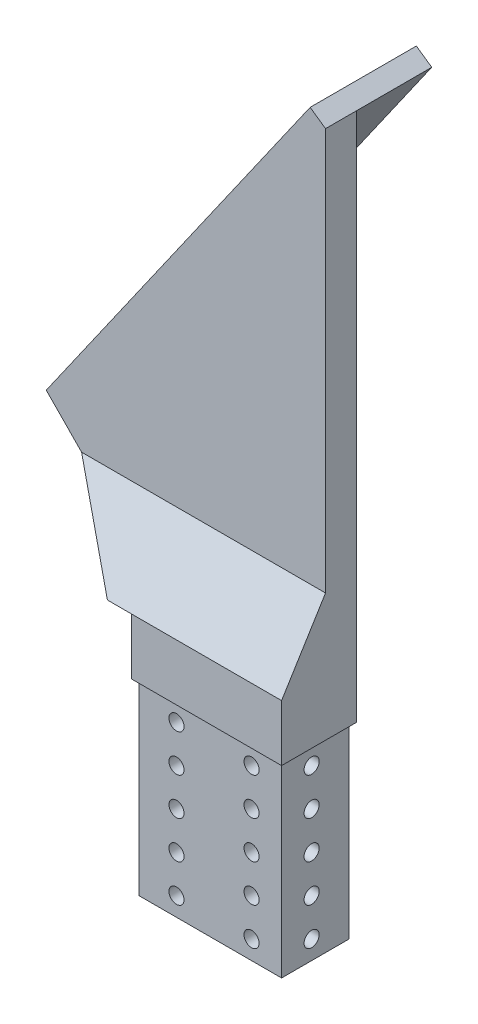
from build123d import *

# Parameters (mm, degrees)
BOSS_EXTRUDE1_DEPTH = 25.4
SKETCH3_W           = 50.8
SKETCH3_H           = 63.5
CUT_EXTRUDE1_DEPTH  = 1.27
SKETCH4_W           = 25.4
SKETCH4_H           = 63.5
CUT_EXTRUDE2_DEPTH  = 1.27
SKETCH5_W           = 50.8
SKETCH5_H           = 63.5
CUT_EXTRUDE3_DEPTH  = 1.27
SKETCH6_W           = 25.4
SKETCH6_H           = 63.5
CUT_EXTRUDE4_DEPTH  = 1.27
SKETCH7_W           = 101.6
SKETCH7_H           = 171.45
CUT_EXTRUDE5_DEPTH  = 298.299377732
CUT_EXTRUDE7_DEPTH  = 275.74300719
CUT_EXTRUDE6_DEPTH  = 275.74300719
CUT_EXTRUDE8_DEPTH  = 270.171161327
SKETCH11_R          = 2.5527
CUT_EXTRUDE9_DEPTH  = 257.980175398
SKETCH12_R          = 2.5527
CUT_EXTRUDE10_DEPTH = 258.446718511
BOSS_EXTRUDE2_DEPTH = 25.4
CUT_EXTRUDE11_DEPTH = 263.236499242
CUT_EXTRUDE12_DEPTH = 261.839402023
CUT_EXTRUDE13_DEPTH = 266.056834631


with BuildPart() as part:
    # Sketch1 → Boss-Extrude1 (new body)
    with BuildSketch(Plane.XY):
        Polygon((50.8, 82.55), (152.4, 82.55), (152.4, 254), (-101.6, 254), (-101.6, 82.55), (0, 82.55), (0, 0), (50.8, 0), align=None)
    extrude(amount=BOSS_EXTRUDE1_DEPTH)

    # Sketch3 → Cut-Extrude1 (cut)
    with BuildSketch(Plane.XY.offset(25.4)):
        with Locations((25.4, 31.75)):
            Rectangle(SKETCH3_W, SKETCH3_H)
    extrude(amount=-CUT_EXTRUDE1_DEPTH, mode=Mode.SUBTRACT)

    # Sketch4 → Cut-Extrude2 (cut)
    with BuildSketch(Plane.ZY):
        with Locations((12.7, 31.75)):
            Rectangle(SKETCH4_W, SKETCH4_H)
    extrude(amount=-CUT_EXTRUDE2_DEPTH, mode=Mode.SUBTRACT)

    # Sketch5 → Cut-Extrude3 (cut)
    with BuildSketch(Plane(origin=(0, 0, 0), x_dir=(-1, 0, 0), z_dir=(0, 0, -1))):
        with Locations((-25.4, 31.75)):
            Rectangle(SKETCH5_W, SKETCH5_H)
    extrude(amount=-CUT_EXTRUDE3_DEPTH, mode=Mode.SUBTRACT)

    # Sketch6 → Cut-Extrude4 (cut)
    with BuildSketch(Plane(origin=(50.8, 0, 0), x_dir=(0, 0, -1), z_dir=(1, 0, 0))):
        with Locations((-12.7, 31.75)):
            Rectangle(SKETCH6_W, SKETCH6_H)
    extrude(amount=-CUT_EXTRUDE4_DEPTH, mode=Mode.SUBTRACT)

    # Sketch7 → Cut-Extrude5 (cut, through all)
    with BuildSketch(Plane.XY.offset(25.4)):
        with Locations((101.6, 168.275)):
            Rectangle(SKETCH7_W, SKETCH7_H)
    extrude(amount=-CUT_EXTRUDE5_DEPTH, mode=Mode.SUBTRACT)

    # Sketch9 → Cut-Extrude7 (cut, through all)
    with BuildSketch(Plane.XY.offset(25.4)):
        Polygon((34.65764308, 254), (50.8, 254), (50.8, 242.697), align=None)
    extrude(amount=-CUT_EXTRUDE7_DEPTH, mode=Mode.SUBTRACT)

    # Sketch8 → Cut-Extrude6 (cut, through all)
    with BuildSketch(Plane.XY.offset(25.4)):
        Polygon((34.65764308, 254), (-101.6, 59.403918632), (-101.6, 254), align=None)
    extrude(amount=-CUT_EXTRUDE6_DEPTH, mode=Mode.SUBTRACT)

    # Sketch10 → Cut-Extrude8 (cut, through all)
    with BuildSketch(Plane.XY.offset(25.4)):
        Polygon((34.65764308, 254), (45.59768076, 246.339703148), (-84.029822158, 61.212443237), (-94.969859838, 68.872740089), align=None)
    extrude(amount=-CUT_EXTRUDE8_DEPTH, mode=Mode.SUBTRACT)

    # Sketch11 → Cut-Extrude9 (cut, through all)
    with BuildSketch(Plane.XY.offset(24.13)):
        with Locations((13.97, 57.15)):
            Circle(SKETCH11_R)
        with Locations((13.97, 44.45)):
            Circle(SKETCH11_R)
        with Locations((13.97, 31.75)):
            Circle(SKETCH11_R)
        with Locations((13.97, 19.05)):
            Circle(SKETCH11_R)
        with Locations((13.97, 6.35)):
            Circle(SKETCH11_R)
        with Locations((39.37, 44.45)):
            Circle(SKETCH11_R)
        with Locations((39.37, 31.75)):
            Circle(SKETCH11_R)
        with Locations((39.37, 19.05)):
            Circle(SKETCH11_R)
        with Locations((39.37, 6.35)):
            Circle(SKETCH11_R)
        with Locations((39.37, 57.15)):
            Circle(SKETCH11_R)
    extrude(amount=-CUT_EXTRUDE9_DEPTH, mode=Mode.SUBTRACT)

    # Sketch12 → Cut-Extrude10 (cut, through all)
    with BuildSketch(Plane.ZY.offset(-1.27)):
        with Locations((13.97, 57.15)):
            Circle(SKETCH12_R)
        with Locations((13.97, 44.45)):
            Circle(SKETCH12_R)
        with Locations((13.97, 31.75)):
            Circle(SKETCH12_R)
        with Locations((13.97, 19.05)):
            Circle(SKETCH12_R)
        with Locations((13.97, 6.35)):
            Circle(SKETCH12_R)
    extrude(amount=-CUT_EXTRUDE10_DEPTH, mode=Mode.SUBTRACT)

    # Sketch17 → Boss-Extrude2 (add)
    with BuildSketch(Plane(origin=(0, 0, 0), x_dir=(-1, 0, 0), z_dir=(0, 0, -1))):
        Polygon((-45.59768076, 246.339703148), (-50.799296241, 242.697492777), (68.987953783, 71.623570423), (74.189569264, 75.265780794), align=None)
    extrude(amount=BOSS_EXTRUDE2_DEPTH)

    # Sketch18 → Cut-Extrude11 (cut, through all)
    with BuildSketch(Plane(origin=(0, 0, -25.4), x_dir=(-1, 0, 0), z_dir=(0, 0, -1))):
        Polygon((61.337185427, 82.55), (69.089104065, 82.55), (74.189569264, 75.265780794), (68.987953783, 71.623570423), align=None)
    extrude(amount=-CUT_EXTRUDE11_DEPTH, mode=Mode.SUBTRACT)

    # Sketch19 → Cut-Extrude12 (cut, through all)
    with BuildSketch(Plane.XY.offset(25.4)):
        Polygon((-8.129104065, 82.55), (-43.681300995, 118.836103311), (-69.089104065, 82.55), align=None)
    extrude(amount=-CUT_EXTRUDE12_DEPTH, mode=Mode.SUBTRACT)

    # Sketch20 → Cut-Extrude13 (cut, through all)
    with BuildSketch(Plane(origin=(50.8, 0, 0), x_dir=(0, 0, -1), z_dir=(1, 0, 0))):
        Polygon((-25.4, 82.55), (-10.533653682, 106.639703148), (-10.533653682, 246.339703148), (-25.4, 246.339703148), align=None)
    extrude(amount=-CUT_EXTRUDE13_DEPTH, mode=Mode.SUBTRACT)


solid = part.part
